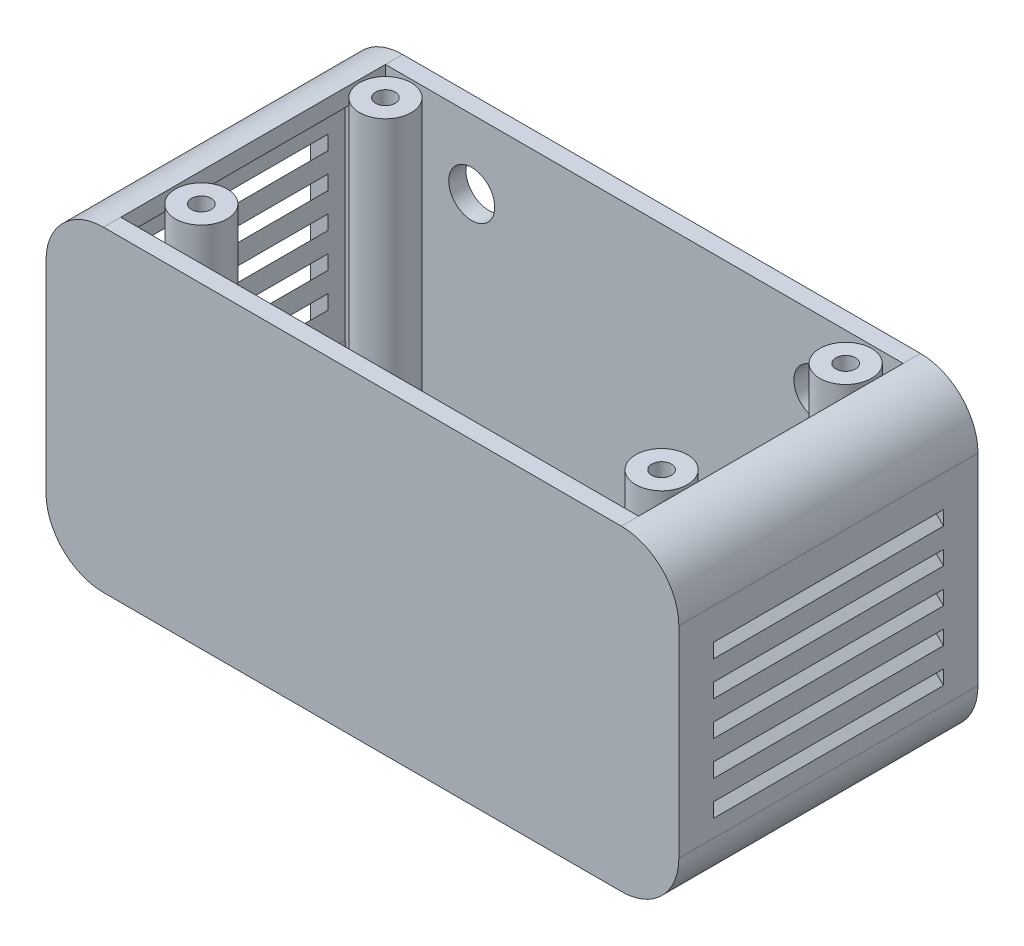
from build123d import *
from build123d.topology import SkipClean

# Parameters (mm, degrees)
BOSS_EXTRUDE1_DEPTH     = 52
SHELL1_START            = 3
SHELL1_DEPTH            = 46
SKETCH2_R               = 4.5
BOSS_EXTRUDE2_DEPTH     = 52
SKETCH3_R               = 3.25
CUT_EXTRUDE1_DEPTH      = 49
SKETCH4_R               = 1.7
CUT_EXTRUDE2_DEPTH      = 91.166512631
CUT_EXTRUDE3_DEPTH      = 20
CUT_EXTRUDE3_DEPTH_BACK = 20
CUT_EXTRUDE4_DEPTH      = 3.5
SKETCH7_R               = 4
CUT_EXTRUDE5_DEPTH      = 3.5
SKETCH8_W               = 6
SKETCH8_H               = 20
BOSS_EXTRUDE3_DEPTH     = 8
SKETCH9_W               = 1.9
SKETCH9_H               = 16.6
CUT_EXTRUDE6_DEPTH      = 6
SKETCH10_R              = 15
SKETCH10_R_2            = 9.1
BOSS_EXTRUDE4_DEPTH     = 8
SKETCH11_R              = 9.1
CUT_EXTRUDE7_DEPTH      = 3.5


# Read off the part's stored shape, not the designer's step: Shell1
with BuildPart() as part:
    # Sketch1 → Boss-Extrude1 (new body)
    with BuildSketch(Plane.XY):
        with BuildLine():
            Line((-45, -55), (45, -55))
            ThreePointArc((45, -55), (52.071067812, -52.071067812), (55, -45))
            Line((55, -45), (55, -10))
            ThreePointArc((55, -10), (52.071067812, -2.928932188), (45, 0))
            Line((45, 0), (-45, 0))
            ThreePointArc((-45, 0), (-52.071067812, -2.928932188), (-55, -10))
            Line((-55, -10), (-55, -45))
            ThreePointArc((-55, -45), (-52.071067812, -52.071067812), (-45, -55))
        make_face()
    extrude(amount=BOSS_EXTRUDE1_DEPTH)

    # Shell1 outline → Shell1 (cut)
    with BuildSketch(Plane.XY.offset(SHELL1_START)):
        with BuildLine():
            Line((45, -3), (45, 0))
            Line((45, 0), (-45, 0))
            Line((-45, 0), (-45, -3))
            ThreePointArc((-45, -3), (-49.949747468, -5.050252532), (-52, -10))
            Line((-52, -10), (-52, -45))
            ThreePointArc((-52, -45), (-49.949747468, -49.949747468), (-45, -52))
            Line((-45, -52), (45, -52))
            ThreePointArc((45, -52), (49.949747468, -49.949747468), (52, -45))
            Line((52, -45), (52, -10))
            ThreePointArc((52, -10), (49.949747468, -5.050252532), (45, -3))
        make_face()
    extrude(amount=SHELL1_DEPTH, mode=Mode.SUBTRACT)

    # Sketch2 → Boss-Extrude2 (add)
    with BuildSketch(Plane(origin=(0, 0, 0), x_dir=(1, 0, 0), z_dir=(0, 1, 0))):
        with Locations(Location((-40, -8, 0), (0, 0, 270))):
            Circle(SKETCH2_R)
        with Locations(Location((40, -8, 0), (0, 0, 270))):
            Circle(SKETCH2_R)
        with Locations(Location((-40, -40, 0), (0, 0, 270))):
            Circle(SKETCH2_R)
        with Locations(Location((40, -40, 0), (0, 0, 270))):
            Circle(SKETCH2_R)
    extrude(amount=-BOSS_EXTRUDE2_DEPTH)

    # Sketch3 → Cut-Extrude1 (cut)
    with BuildSketch(Plane.XZ.offset(55)):
        with Locations(Location((-40, 8, 0), (0, 0, 270))):
            Circle(SKETCH3_R)
        with Locations(Location((40, 8, 0), (0, 0, 270))):
            Circle(SKETCH3_R)
        with Locations(Location((-40, 40, 0), (0, 0, 270))):
            Circle(SKETCH3_R)
        with Locations(Location((40, 40, 0), (0, 0, 270))):
            Circle(SKETCH3_R)
    extrude(amount=-CUT_EXTRUDE1_DEPTH, mode=Mode.SUBTRACT)

    # Sketch4 → Cut-Extrude2 (cut, through all)
    with BuildSketch(Plane.XZ.offset(6)):
        with Locations(Location((-40, 8, 0), (0, 0, 270))):
            Circle(SKETCH4_R)
        with Locations(Location((40, 8, 0), (0, 0, 270))):
            Circle(SKETCH4_R)
        with Locations(Location((-40, 40, 0), (0, 0, 270))):
            Circle(SKETCH4_R)
        with Locations(Location((40, 40, 0), (0, 0, 270))):
            Circle(SKETCH4_R)
    extrude(amount=-CUT_EXTRUDE2_DEPTH, mode=Mode.SUBTRACT)

    # Sketch5 → Cut-Extrude3 (cut, two sides: drawn at the far end of the back side and taken through both)
    with BuildSketch(Plane.XY.offset(26).offset(-CUT_EXTRUDE3_DEPTH_BACK)):
        Polygon((-51, -14), (-51, -11.5), (-55.5, -16), (-55.5, -18.5), align=None)
        Polygon((51, -14), (51, -11.5), (55.5, -16), (55.5, -18.5), align=None)
        Polygon((-51, -20), (-51, -17.5), (-55.5, -22), (-55.5, -24.5), align=None)
        Polygon((51, -20), (51, -17.5), (55.5, -22), (55.5, -24.5), align=None)
        Polygon((-51, -26), (-51, -23.5), (-55.5, -28), (-55.5, -30.5), align=None)
        Polygon((51, -26), (51, -23.5), (55.5, -28), (55.5, -30.5), align=None)
        Polygon((-51, -32), (-51, -29.5), (-55.5, -34), (-55.5, -36.5), align=None)
        Polygon((51, -32), (51, -29.5), (55.5, -34), (55.5, -36.5), align=None)
        Polygon((-51, -38), (-51, -35.5), (-55.5, -40), (-55.5, -42.5), align=None)
        Polygon((51, -38), (51, -35.5), (55.5, -40), (55.5, -42.5), align=None)
    extrude(amount=CUT_EXTRUDE3_DEPTH + CUT_EXTRUDE3_DEPTH_BACK, mode=Mode.SUBTRACT)

    # Sketch6 → Cut-Extrude4 (cut)
    with BuildSketch(Plane.XZ.offset(55)):
        with BuildLine():
            Line((-34.5, 12), (-34.5, 40))
            ThreePointArc((-34.5, 40), (-33, 41.5), (-31.5, 40))
            Line((-31.5, 40), (-31.5, 12))
            ThreePointArc((-31.5, 12), (-33, 10.5), (-34.5, 12))
        make_face()
        with BuildLine():
            Line((-28.5, 12), (-28.5, 40))
            ThreePointArc((-28.5, 40), (-27, 41.5), (-25.5, 40))
            Line((-25.5, 40), (-25.5, 12))
            ThreePointArc((-25.5, 12), (-27, 10.5), (-28.5, 12))
        make_face()
        with BuildLine():
            Line((-22.5, 12), (-22.5, 40))
            ThreePointArc((-22.5, 40), (-21, 41.5), (-19.5, 40))
            Line((-19.5, 40), (-19.5, 12))
            ThreePointArc((-19.5, 12), (-21, 10.5), (-22.5, 12))
        make_face()
        with BuildLine():
            Line((-16.5, 12), (-16.5, 40))
            ThreePointArc((-16.5, 40), (-15, 41.5), (-13.5, 40))
            Line((-13.5, 40), (-13.5, 12))
            ThreePointArc((-13.5, 12), (-15, 10.5), (-16.5, 12))
        make_face()
        with BuildLine():
            Line((-10.5, 12), (-10.5, 40))
            ThreePointArc((-10.5, 40), (-9, 41.5), (-7.5, 40))
            Line((-7.5, 40), (-7.5, 12))
            ThreePointArc((-7.5, 12), (-9, 10.5), (-10.5, 12))
        make_face()
        with BuildLine():
            Line((-4.5, 12), (-4.5, 40))
            ThreePointArc((-4.5, 40), (-3, 41.5), (-1.5, 40))
            Line((-1.5, 40), (-1.5, 12))
            ThreePointArc((-1.5, 12), (-3, 10.5), (-4.5, 12))
        make_face()
        with BuildLine():
            Line((31.5, 12), (31.5, 40))
            ThreePointArc((31.5, 40), (33, 41.5), (34.5, 40))
            Line((34.5, 40), (34.5, 12))
            ThreePointArc((34.5, 12), (33, 10.5), (31.5, 12))
        make_face()
    extrude(amount=-CUT_EXTRUDE4_DEPTH, mode=Mode.SUBTRACT)

    # Sketch7 → Cut-Extrude5 (cut)
    with BuildSketch(Plane(origin=(0, 0, 0), x_dir=(-1, 0, 0), z_dir=(0, 0, -1))):
        with Locations((30, -12)):
            Circle(SKETCH7_R)
        with Locations((-30, -12)):
            Circle(SKETCH7_R)
    extrude(amount=-CUT_EXTRUDE5_DEPTH, mode=Mode.SUBTRACT)

    # Sketch8 → Boss-Extrude3 (add)
    with BuildSketch(Plane(origin=(0, -52, 0), x_dir=(1, 0, 0), z_dir=(0, 1, 0))):
        with Locations((-44, -26)):
            Rectangle(SKETCH8_W, SKETCH8_H)
    extrude(amount=BOSS_EXTRUDE3_DEPTH)

    # Sketch9 → Cut-Extrude6 (cut)
    with BuildSketch(Plane(origin=(0, -44, 0), x_dir=(1, 0, 0), z_dir=(0, 1, 0))):
        with Locations((-44, -26)):
            Rectangle(SKETCH9_W, SKETCH9_H)
    extrude(amount=-CUT_EXTRUDE6_DEPTH, mode=Mode.SUBTRACT)

    # Sketch10 → Boss-Extrude4 (add)
    with BuildSketch(Plane(origin=(0, -52, 0), x_dir=(1, 0, 0), z_dir=(0, 1, 0))):
        with Locations(Location((15, -26, 0), (0, 0, 270))):
            Circle(SKETCH10_R)
        with Locations(Location((15, -26, 0), (0, 0, 270))):
            Circle(SKETCH10_R_2, mode=Mode.SUBTRACT)
    extrude(amount=BOSS_EXTRUDE4_DEPTH)

    # Sketch11 → Cut-Extrude7 (cut)
    with SkipClean():  # the faces are left unmerged after this step: merging them gives an invalid solid
        with BuildSketch(Plane.XZ.offset(55)):
            with Locations(Location((15, 26, 0), (0, 0, 270))):
                Circle(SKETCH11_R)
        extrude(amount=-CUT_EXTRUDE7_DEPTH, mode=Mode.SUBTRACT)


solid = part.part
